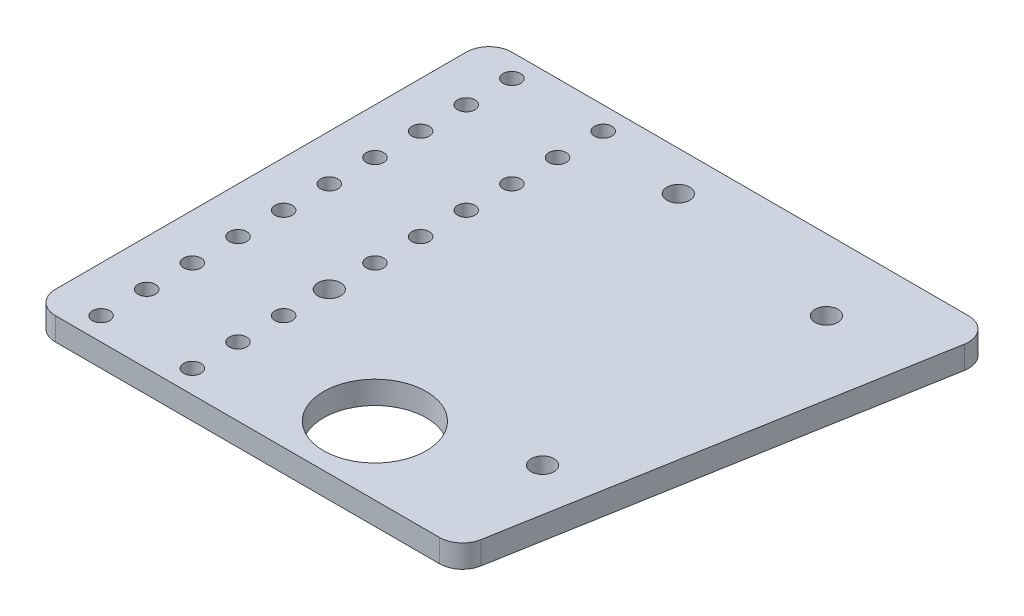
from build123d import *

# Parameters (mm, degrees)
INITIAL_PLATE_DEPTH         = 6.35
SKETCH3_R                   = 2.413
INITIAL_MOUNTING_HOLE_DEPTH = 104.251171547
MOUNTING_PATTERN_COUNT      = 10
MOUNTING_PATTERN_PITCH      = 12.7
SKETCH2_R                   = 3.175
BEARING_STACK_HOLES_DEPTH   = 104.251171547
FILLET1_R                   = 6.35
SKETCH4_R                   = 14.2875
CUT_EXTRUDE1_DEPTH          = 103.351488215


with BuildPart() as part:
    # Sketch1 → Initial Plate (new body)
    with BuildSketch(Plane(origin=(0, 0, 0), x_dir=(1, 0, 0), z_dir=(0, 1, 0))):
        Polygon((-64.403593083, -58.02125503), (54.172880367, -58.02125503), (76.566406917, 68.97874497), (-64.403593083, 68.97874497), align=None)
    extrude(amount=INITIAL_PLATE_DEPTH)

    # Sketch3 → Initial Mounting Hole (cut, through all)
    with BuildSketch(Plane(origin=(0, 6.35, 0), x_dir=(1, 0, 0), z_dir=(0, 1, 0))):
        with Locations((-51.703593083, -51.67125503)):
            Circle(SKETCH3_R)
        with Locations((-26.303593083, -51.67125503)):
            Circle(SKETCH3_R)
    initial_mounting_hole = extrude(amount=-INITIAL_MOUNTING_HOLE_DEPTH, mode=Mode.SUBTRACT)

    # Mounting Pattern: Initial Mounting Hole ×10
    with Locations(*[(0, 0, -i * MOUNTING_PATTERN_PITCH) for i in range(1, MOUNTING_PATTERN_COUNT)]):
        add(initial_mounting_hole, mode=Mode.SUBTRACT)

    # Sketch2 → Bearing Stack Holes (cut, through all)
    with BuildSketch(Plane(origin=(0, 6.35, 0), x_dir=(1, 0, 0), z_dir=(0, 1, 0))):
        with Locations((-26.303593083, -13.57125503)):
            Circle(SKETCH2_R)
        with Locations((49.243157186, 49.193730621)):
            Circle(SKETCH2_R)
        with Locations((45.737063665, -26.273966523)):
            Circle(SKETCH2_R)
        with Locations((-0.785076667, 58.015058047)):
            Circle(SKETCH2_R)
    extrude(amount=-BEARING_STACK_HOLES_DEPTH, mode=Mode.SUBTRACT)

    # Fillet1
    fillet1_edges = [part.edges().sort_by_distance(p)[0] for p in [
        (76.566406917, 3.175, -68.97874497),
        (54.172880367, 3.175, 58.02125503),
        (-64.403593083, 3.175, 58.02125503),
        (-64.403593083, 3.175, -68.97874497),
    ]]
    fillet(fillet1_edges, radius=FILLET1_R)

    # Sketch4 → Cut-Extrude1 (cut, through all)
    with BuildSketch(Plane(origin=(0, 6.35, 0), x_dir=(1, 0, 0), z_dir=(0, 1, 0))):
        with Locations((11.792603678, -38.977523898)):
            Circle(SKETCH4_R)
    extrude(amount=-CUT_EXTRUDE1_DEPTH, mode=Mode.SUBTRACT)


solid = part.part
